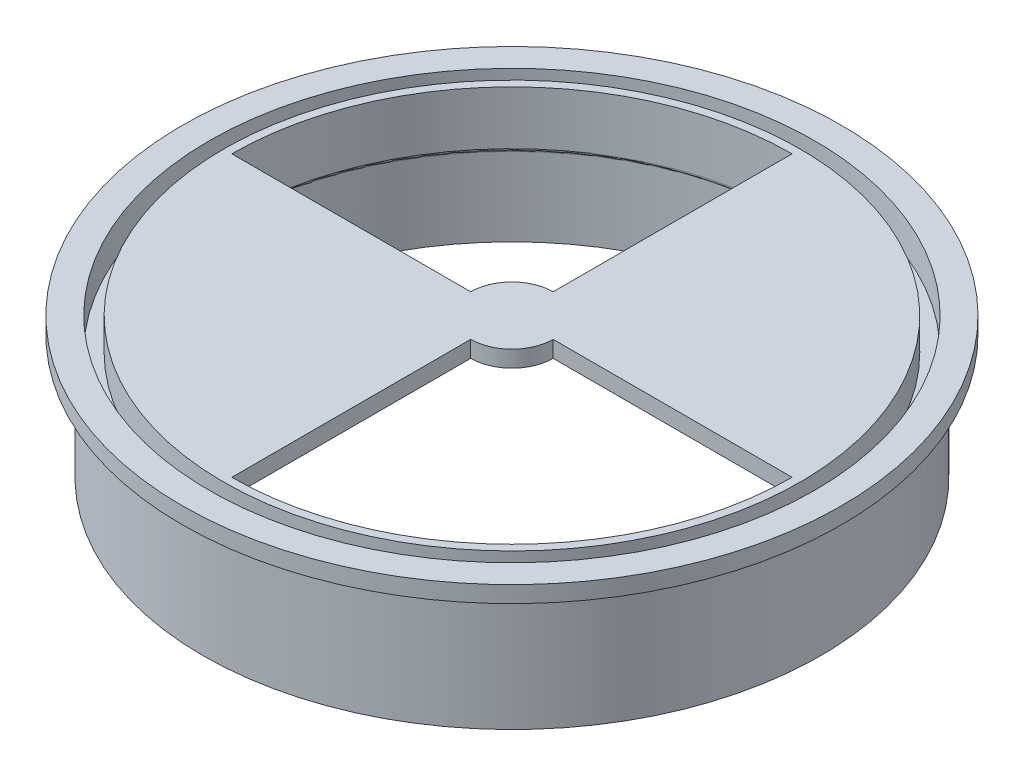
from build123d import *

# Parameters (mm, degrees)
CROQUIS1_R              = 37.5
CROQUIS1_R_2            = 35
SALIENTE_EXTRUIR1_DEPTH = 15
CROQUIS2_R              = 40
SALIENTE_EXTRUIR2_DEPTH = 2
CORTAR_EXTRUIR1_DEPTH   = 10
CROQUIS5_W              = 2
CROQUIS5_H              = 4
SALIENTE_EXTRUIR3_START = -2
CROQUIS8_R              = 35
CROQUIS8_R_2            = 34
SALIENTE_EXTRUIR3_DEPTH = 7
REDONDEO1_R             = 0.5


with BuildPart() as part:
    # Croquis1 → Saliente-Extruir1 (new body)
    with BuildSketch(Plane(origin=(0, 17, 0), x_dir=(1, 0, 0), z_dir=(0, 1, 0))):
        with Locations(Location((13.541348433, 6.626768313, 0), (0, 0, 270))):
            Circle(CROQUIS1_R)
        with Locations(Location((13.541348433, 6.626768313, 0), (0, 0, 270))):
            Circle(CROQUIS1_R_2, mode=Mode.SUBTRACT)
    extrude(amount=SALIENTE_EXTRUIR1_DEPTH)

    # Croquis2 → Saliente-Extruir2 (add)
    with BuildSketch(Plane(origin=(0, 32, 0), x_dir=(1, 0, 0), z_dir=(0, 1, 0))):
        with Locations(Location((13.541348433, 6.626768313, 0), (0, 0, 270))):
            Circle(CROQUIS2_R)
    extrude(amount=SALIENTE_EXTRUIR2_DEPTH)

    # Croquis7 → Cortar-Extruir1 (cut)
    with BuildSketch(Plane.XZ.offset(-32)):
        with BuildLine():
            Line((13.541348433, -41.626768313), (13.541348433, -11.626768313))
            ThreePointArc((13.541348433, -11.626768313), (10.005814527, -10.162302219), (8.541348433, -6.626768313))
            Line((8.541348433, -6.626768313), (-21.458651567, -6.626768313))
            ThreePointArc((-21.458651567, -6.626768313), (-11.207388908, -31.375505654), (13.541348433, -41.626768313))
        make_face()
        with BuildLine():
            Line((48.541348433, -6.626768313), (18.541348433, -6.626768313))
            ThreePointArc((18.541348433, -6.626768313), (17.076882339, -3.091234407), (13.541348433, -1.626768313))
            Line((13.541348433, -1.626768313), (13.541348433, 28.373231687))
            ThreePointArc((13.541348433, 28.373231687), (38.290085775, 18.121969029), (48.541348433, -6.626768313))
        make_face()
    extrude(amount=-CORTAR_EXTRUIR1_DEPTH, mode=Mode.SUBTRACT)

    # Cortar-Barrer1: sweep along a path in Croquis6
    with BuildLine(Plane(origin=(0, 33, 0), x_dir=(1, 0, 0), z_dir=(0, 1, 0))) as cortar_barrer1_path:
        CenterArc((13.541348433, 6.626768313), 36.25, 0, 360)
    # Croquis5 → Cortar-Barrer1 (sweep, cut)
    with BuildSketch(Plane.XY.offset(-6.626768313)):
        with Locations((-22.208651567, 32.1)):
            Rectangle(CROQUIS5_W, CROQUIS5_H)
    sweep(path=cortar_barrer1_path.line, mode=Mode.SUBTRACT)


with BuildPart() as cortar_barrer1_piece_1:
    # of the separate pieces the step leaves, piece 1, a body of its own (cortar_barrer1_pieces)
    add(part.part.solids().sort_by_distance((13.541348433, 32, 33.373231687))[0])



with BuildPart() as cortar_barrer1_piece_2:
    # of the separate pieces the step leaves, piece 2, a body of its own (cortar_barrer1_pieces)
    add(part.part.solids().sort_by_distance((18.541348433, 34, -6.626768313))[0])


with BuildPart() as cortar_barrer1_piece_1_1:
    add(cortar_barrer1_piece_1.part)

    add(cortar_barrer1_piece_2.part)  # Saliente-Extruir3 merges Cortar-Barrer1 piece 2
    # Croquis8 → Saliente-Extruir3 (add)
    with BuildSketch(Plane.XZ.offset(-32).offset(SALIENTE_EXTRUIR3_START)):
        with Locations(Location((13.541348433, -6.626768313, 0), (0, 0, 90))):
            Circle(CROQUIS8_R)
        with Locations(Location((13.541348433, -6.626768313, 0), (0, 0, 270))):
            Circle(CROQUIS8_R_2, mode=Mode.SUBTRACT)
    extrude(amount=SALIENTE_EXTRUIR3_DEPTH)

    # Redondeo1
    redondeo1_edges = [cortar_barrer1_piece_1_1.edges().sort_by_distance(p)[0] for p in [
        (13.541348433, 27, 27.373231687),
        (13.541348433, 27, -41.626768313),
    ]]
    fillet(redondeo1_edges, radius=REDONDEO1_R - 0.0001)  # a hair under: the kernel refuses the full size


solid = cortar_barrer1_piece_1_1.part
